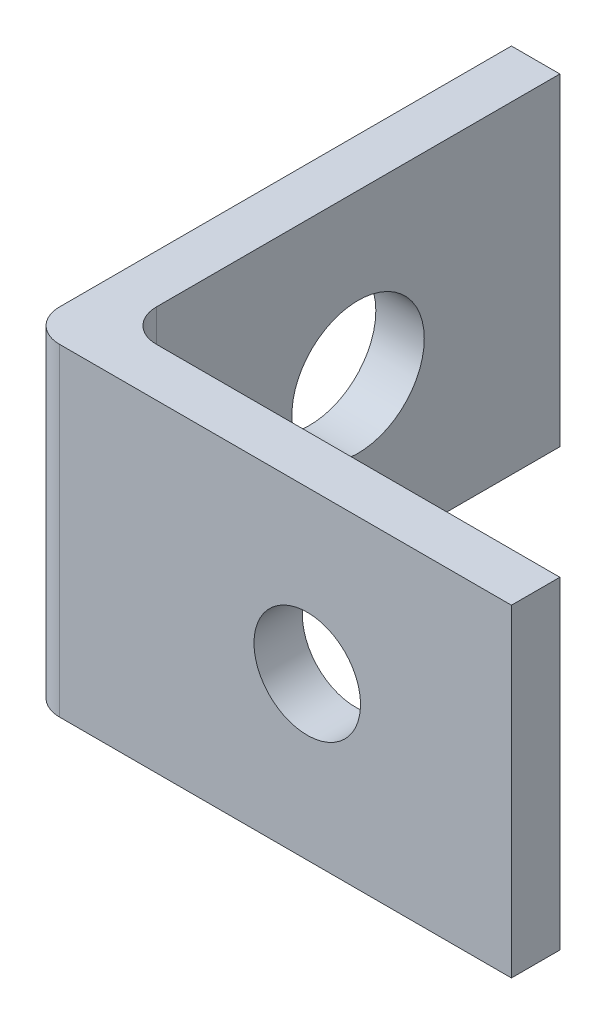
from build123d import *

# Parameters (mm, degrees)
EXTRUDE_1_DEPTH     = 10
SKETCH_6_R          = 1.65
CUT_EXTRUDE_3_DEPTH = 8
SKETCH_12_R         = 2.05
CUT_EXTRUDE_5_DEPTH = 95


with BuildPart() as part:
    # Эскиз1 → Бобышка-Вытянуть1 (new body)
    with BuildSketch(Plane(origin=(0, 0, 0), x_dir=(1, 0, 0), z_dir=(0, 1, 0))):
        with BuildLine():
            Line((0, 1), (0, 15))
            Line((0, 15), (1.5, 15))
            Line((1.5, 15), (1.5, 2.5))
            ThreePointArc((1.5, 2.5), (1.792893219, 1.792893219), (2.5, 1.5))
            Line((2.5, 1.5), (15, 1.5))
            Line((15, 1.5), (15, 0))
            Line((15, 0), (1, 0))
            ThreePointArc((1, 0), (0.292893219, 0.292893219), (0, 1))
        make_face()
    extrude(amount=EXTRUDE_1_DEPTH)

    # Эскиз6 → Вырез-Вытянуть3 (cut)
    with BuildSketch(Plane(origin=(-307.940790238, -349.204468703, -1.5), x_dir=(-0.9998892265297747, 0.014884040771535371, 0), z_dir=(0, 0, -1))):
        with Locations((-311.309295343, 358.877763083)):
            Circle(SKETCH_6_R)
    extrude(amount=-CUT_EXTRUDE_3_DEPTH, mode=Mode.SUBTRACT)

    # Эскиз12 → Вырез-Вытянуть5 (cut)
    with BuildSketch(Plane(origin=(1.5, 0, 0), x_dir=(0, 0, -1), z_dir=(1, 0, 0))):
        with Locations((8.75, 5)):
            Circle(SKETCH_12_R)
    extrude(amount=-CUT_EXTRUDE_5_DEPTH, mode=Mode.SUBTRACT)


solid = part.part
